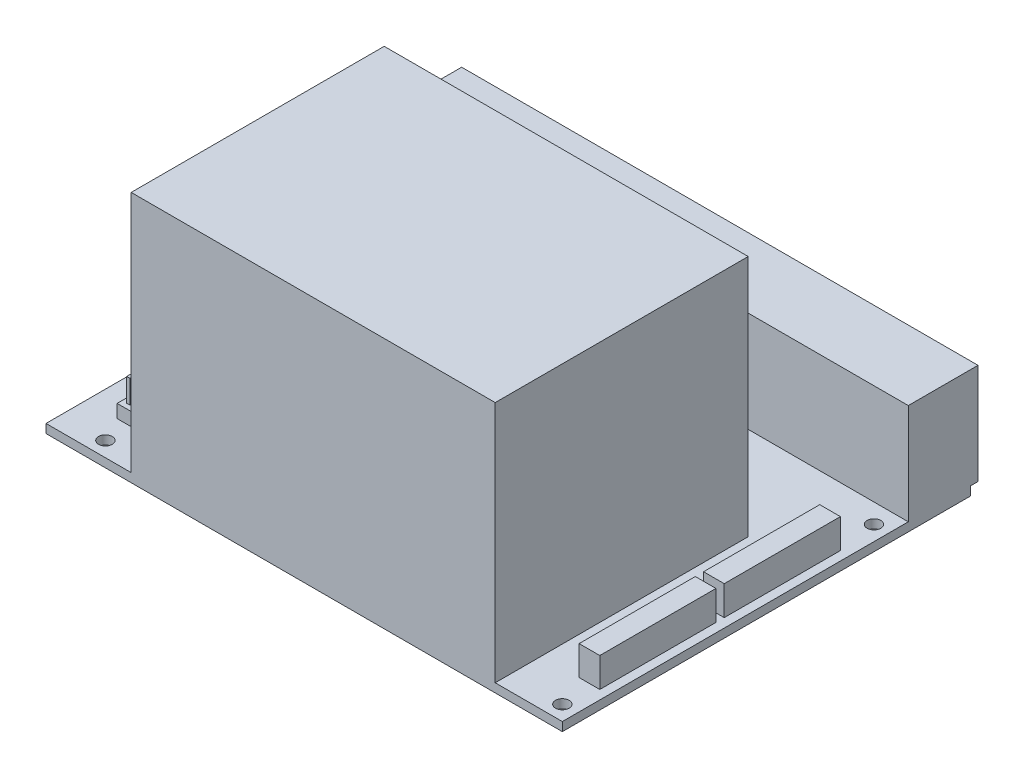
from build123d import *

# Parameters (mm, degrees)
SKETCH1_W           = 100
SKETCH1_H           = 79
SKETCH1_R           = 1.325
BOSS_EXTRUDE1_DEPTH = 1.7
SKETCH2_W           = 100
SKETCH2_H           = 19.5
BOSS_EXTRUDE2_DEPTH = 1.5
SKETCH2_2_W         = 100
SKETCH2_2_H         = 19.5
BOSS_EXTRUDE3_DEPTH = 12
SKETCH3_W           = 70.5
SKETCH3_H           = 49
BOSS_EXTRUDE4_DEPTH = 47
SKETCH4_W           = 5.05
SKETCH4_H           = 50.75
BOSS_EXTRUDE5_DEPTH = 2.55
SKETCH5_W           = 0.64
SKETCH5_H           = 0.64
BOSS_EXTRUDE6_DEPTH = 4.5
SKETCH6_W           = 4
SKETCH6_H           = 22.5
BOSS_EXTRUDE7_DEPTH = 5.7


with BuildPart() as part:
    # Sketch1 → Boss-Extrude1 (new body)
    with BuildSketch(Plane(origin=(0, 0, 0), x_dir=(1, 0, 0), z_dir=(0, 1, 0))):
        Rectangle(SKETCH1_W, SKETCH1_H)
        with Locations((-41.4, 23.75)):
            Circle(SKETCH1_R, mode=Mode.SUBTRACT)
        with Locations((-41.4, -36.6)):
            Circle(SKETCH1_R, mode=Mode.SUBTRACT)
        with Locations((47.1, 23.75)):
            Circle(SKETCH1_R, mode=Mode.SUBTRACT)
        with Locations((47.1, -36.6)):
            Circle(SKETCH1_R, mode=Mode.SUBTRACT)
    extrude(amount=BOSS_EXTRUDE1_DEPTH)



with BuildPart() as body_2:
    # Sketch2 → Boss-Extrude2 (new body)
    with BuildSketch(Plane(origin=(0, 0, -39.5), x_dir=(-1, 0, 0), z_dir=(0, 0, -1))):
        with Locations((0, 11.45)):
            Rectangle(SKETCH2_W, SKETCH2_H)
    extrude(amount=BOSS_EXTRUDE2_DEPTH)


with BuildPart() as part_1:
    add(part.part)

    add(body_2.part)  # Boss-Extrude3 merges body 2
    # Sketch2<2> → Boss-Extrude3 (add)
    with BuildSketch(Plane(origin=(0, 0, -39.5), x_dir=(-1, 0, 0), z_dir=(0, 0, -1))):
        with Locations((0, 11.45)):
            Rectangle(SKETCH2_2_W, SKETCH2_2_H)
    extrude(amount=-BOSS_EXTRUDE3_DEPTH)

    # Sketch3 → Boss-Extrude4 (add)
    with BuildSketch(Plane(origin=(0, 1.7, 0), x_dir=(1, 0, 0), z_dir=(0, 1, 0))):
        with Locations((1.75, -15)):
            Rectangle(SKETCH3_W, SKETCH3_H)
    extrude(amount=BOSS_EXTRUDE4_DEPTH)

    # Sketch4 → Boss-Extrude5 (add)
    with BuildSketch(Plane(origin=(0, 1.7, 0), x_dir=(1, 0, 0), z_dir=(0, 1, 0))):
        with Locations((-41.4, -6.425)):
            Rectangle(SKETCH4_W, SKETCH4_H)
    extrude(amount=BOSS_EXTRUDE5_DEPTH)

    # Sketch5 → Boss-Extrude6 (add)
    with BuildSketch(Plane(origin=(0, 4.25, 0), x_dir=(1, 0, 0), z_dir=(0, 1, 0))):
        with Locations((-40.162225594, 17.727225594)):
            Rectangle(SKETCH5_W, SKETCH5_H)
        with Locations((-42.702225594, 17.727225594)):
            Rectangle(SKETCH5_W, SKETCH5_H)
        with Locations((-42.702225594, 15.187225594)):
            Rectangle(SKETCH5_W, SKETCH5_H)
        with Locations((-40.162225594, 15.187225594)):
            Rectangle(SKETCH5_W, SKETCH5_H)
        with Locations((-42.702225594, 12.647225594)):
            Rectangle(SKETCH5_W, SKETCH5_H)
        with Locations((-40.162225594, 12.647225594)):
            Rectangle(SKETCH5_W, SKETCH5_H)
        with Locations((-42.702225594, 10.107225594)):
            Rectangle(SKETCH5_W, SKETCH5_H)
        with Locations((-40.162225594, 10.107225594)):
            Rectangle(SKETCH5_W, SKETCH5_H)
        with Locations((-42.702225594, 7.567225594)):
            Rectangle(SKETCH5_W, SKETCH5_H)
        with Locations((-40.162225594, 7.567225594)):
            Rectangle(SKETCH5_W, SKETCH5_H)
        with Locations((-42.702225594, 5.027225594)):
            Rectangle(SKETCH5_W, SKETCH5_H)
        with Locations((-40.162225594, 5.027225594)):
            Rectangle(SKETCH5_W, SKETCH5_H)
        with Locations((-42.702225594, 2.487225594)):
            Rectangle(SKETCH5_W, SKETCH5_H)
        with Locations((-40.162225594, 2.487225594)):
            Rectangle(SKETCH5_W, SKETCH5_H)
        with Locations((-42.702225594, -0.052774406)):
            Rectangle(SKETCH5_W, SKETCH5_H)
        with Locations((-40.162225594, -0.052774406)):
            Rectangle(SKETCH5_W, SKETCH5_H)
        with Locations((-42.702225594, -2.592774406)):
            Rectangle(SKETCH5_W, SKETCH5_H)
        with Locations((-40.162225594, -2.592774406)):
            Rectangle(SKETCH5_W, SKETCH5_H)
        with Locations((-42.702225594, -5.132774406)):
            Rectangle(SKETCH5_W, SKETCH5_H)
        with Locations((-40.162225594, -5.132774406)):
            Rectangle(SKETCH5_W, SKETCH5_H)
        with Locations((-42.702225594, -7.672774406)):
            Rectangle(SKETCH5_W, SKETCH5_H)
        with Locations((-40.162225594, -7.672774406)):
            Rectangle(SKETCH5_W, SKETCH5_H)
        with Locations((-42.702225594, -10.212774406)):
            Rectangle(SKETCH5_W, SKETCH5_H)
        with Locations((-40.162225594, -10.212774406)):
            Rectangle(SKETCH5_W, SKETCH5_H)
        with Locations((-42.702225594, -12.752774406)):
            Rectangle(SKETCH5_W, SKETCH5_H)
        with Locations((-40.162225594, -12.752774406)):
            Rectangle(SKETCH5_W, SKETCH5_H)
        with Locations((-42.702225594, -15.292774406)):
            Rectangle(SKETCH5_W, SKETCH5_H)
        with Locations((-40.162225594, -15.292774406)):
            Rectangle(SKETCH5_W, SKETCH5_H)
        with Locations((-42.702225594, -17.832774406)):
            Rectangle(SKETCH5_W, SKETCH5_H)
        with Locations((-40.162225594, -17.832774406)):
            Rectangle(SKETCH5_W, SKETCH5_H)
        with Locations((-42.702225594, -20.372774406)):
            Rectangle(SKETCH5_W, SKETCH5_H)
        with Locations((-40.162225594, -20.372774406)):
            Rectangle(SKETCH5_W, SKETCH5_H)
        with Locations((-42.702225594, -22.912774406)):
            Rectangle(SKETCH5_W, SKETCH5_H)
        with Locations((-40.162225594, -22.912774406)):
            Rectangle(SKETCH5_W, SKETCH5_H)
        with Locations((-42.702225594, -25.452774406)):
            Rectangle(SKETCH5_W, SKETCH5_H)
        with Locations((-40.162225594, -25.452774406)):
            Rectangle(SKETCH5_W, SKETCH5_H)
        with Locations((-42.702225594, -27.992774406)):
            Rectangle(SKETCH5_W, SKETCH5_H)
        with Locations((-40.162225594, -27.992774406)):
            Rectangle(SKETCH5_W, SKETCH5_H)
        with Locations((-42.702225594, -30.532774406)):
            Rectangle(SKETCH5_W, SKETCH5_H)
        with Locations((-40.162225594, -30.532774406)):
            Rectangle(SKETCH5_W, SKETCH5_H)
    extrude(amount=BOSS_EXTRUDE6_DEPTH)

    # Sketch6 → Boss-Extrude7 (add)
    with BuildSketch(Plane(origin=(0, 1.7, 0), x_dir=(1, 0, 0), z_dir=(0, 1, 0))):
        with Locations((46.25, 4.85)):
            Rectangle(SKETCH6_W, SKETCH6_H)
        with Locations((46.25, -19.25)):
            Rectangle(SKETCH6_W, SKETCH6_H)
    extrude(amount=BOSS_EXTRUDE7_DEPTH)


solid = part_1.part
